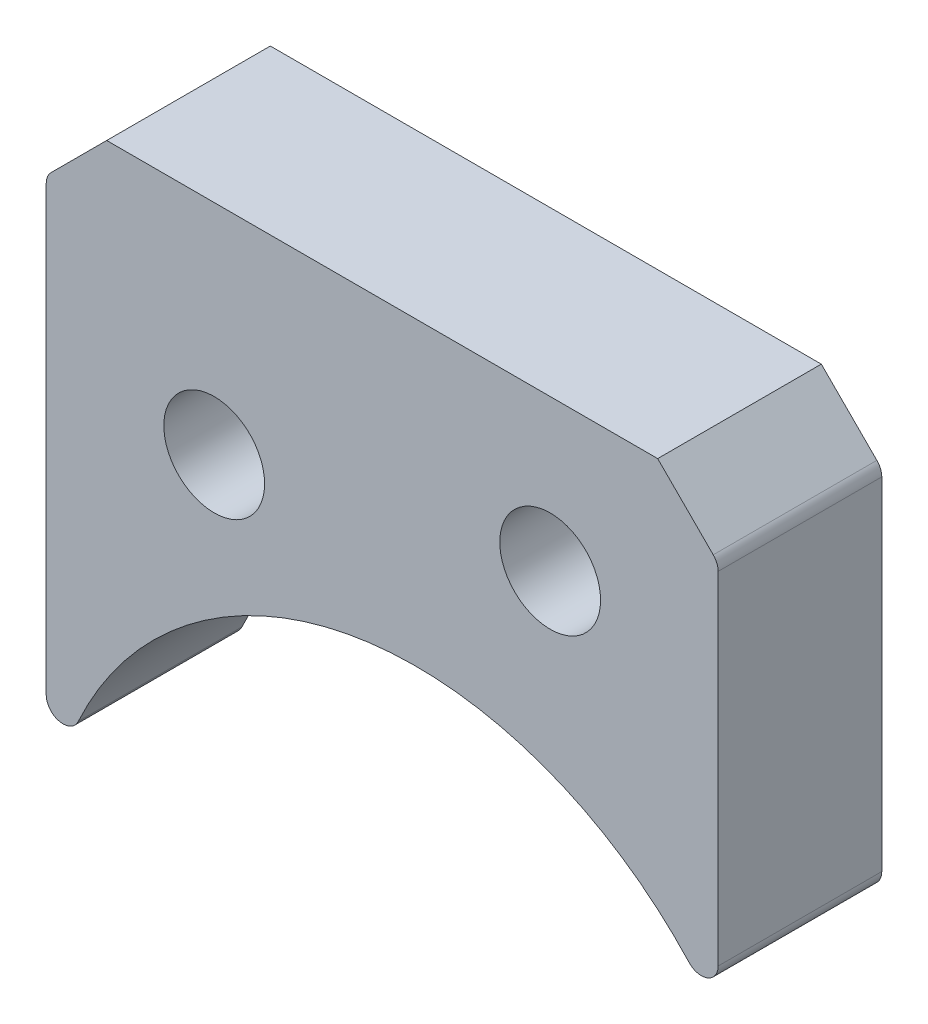
from build123d import *

# Parameters (mm, degrees)
BOSS_EXTRUDE1_DEPTH = 4.87
SKETCH2_R           = 1.5
CUT_EXTRUDE1_DEPTH  = 4.87
CHAMFER1_SIZE       = 1.8
FILLET1_R           = 0.5


with BuildPart() as part:
    # Sketch1 → Boss-Extrude1 (new body)
    with BuildSketch(Plane.XY):
        with BuildLine():
            Line((0, 1.05), (0, 20))
            Line((0, 20), (20, 20))
            Line((20, 20), (20, 6.411123147))
            ThreePointArc((20, 6.411123147), (8.138984385, 10.673194913), (0, 1.05))
        make_face()
    extrude(amount=BOSS_EXTRUDE1_DEPTH)

    # Sketch2 → Cut-Extrude1 (cut)
    with BuildSketch(Plane.XY.offset(4.87)):
        with Locations((5, 13.5)):
            Circle(SKETCH2_R)
        with Locations((15, 15.5)):
            Circle(SKETCH2_R)
    extrude(amount=-CUT_EXTRUDE1_DEPTH, mode=Mode.SUBTRACT)

    # Chamfer1
    chamfer1_edges = [part.edges().sort_by_distance(p)[0] for p in [
        (0, 20, 2.435),
        (20, 20, 2.435),
    ]]
    chamfer(chamfer1_edges, length=CHAMFER1_SIZE)

    # Fillet1
    fillet1_edges = [part.edges().sort_by_distance(p)[0] for p in [
        (20, 18.2, 2.435),
        (0, 18.2, 2.435),
        (0, 1.05, 2.435),
        (20, 6.411123147, 2.435),
    ]]
    fillet(fillet1_edges, radius=FILLET1_R)


solid = part.part
